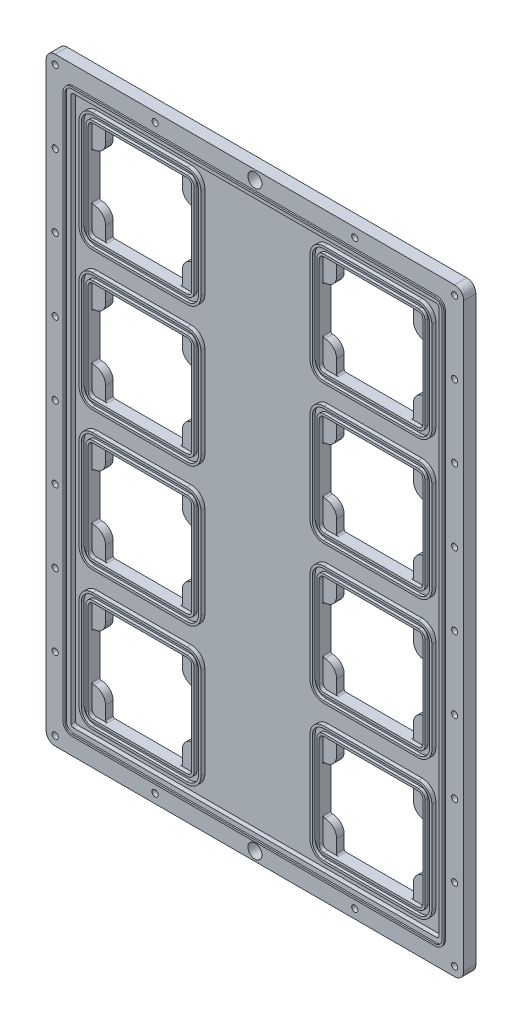
from build123d import *

# Parameters (mm, degrees)
SKETCH1_W            = 292.1
SKETCH1_H            = 419.1
BOSS_EXTRUDE1_DEPTH  = 8.509
SKETCH4_R            = 2.15265
CUT_EXTRUDE1_DEPTH   = 511.92036863
LPATTERN2_COUNT      = 8
LPATTERN2_PITCH      = 50.8
LPATTERN3_COUNT      = 4
LPATTERN3_PITCH      = 69.85
CUT_EXTRUDE3_DEPTH   = 3.175
BOSS_EXTRUDE2_DEPTH  = 1.016
SKETCH7_R            = 4.9022
CUT_EXTRUDE4_DEPTH   = 511.92036863
FILLET1_R            = 6.35
CUT_EXTRUDE5_DEPTH   = 3.175
CUT_EXTRUDE6_DEPTH   = 511.938299235
SKETCH11_R           = 1.1303
CUT_EXTRUDE7_DEPTH   = 3.96875
BOSS_EXTRUDE3_DEPTH  = 2.794
BOSS_EXTRUDE4_DEPTH  = 0.79375
LPATTERN1_COUNT      = 2
LPATTERN1_PITCH      = 161.5948
LPATTERN1_COUNT_DIR2 = 4
LPATTERN1_PITCH_DIR2 = 96.8756


with BuildPart() as part:
    # Sketch1 → Boss-Extrude1 (new body)
    with BuildSketch(Plane.XY):
        with Locations((146.05, 209.55)):
            Rectangle(SKETCH1_W, SKETCH1_H)
    extrude(amount=BOSS_EXTRUDE1_DEPTH)

    # Sketch4 → Cut-Extrude1 (cut, through all)
    with BuildSketch(Plane.XY.offset(8.509)):
        with Locations((6.35, 6.35)):
            Circle(SKETCH4_R)
        with Locations((6.35, 412.75)):
            Circle(SKETCH4_R)
        with Locations((285.75, 412.75)):
            Circle(SKETCH4_R)
        with Locations((285.75, 6.35)):
            Circle(SKETCH4_R)
    cut_extrude1 = extrude(amount=-CUT_EXTRUDE1_DEPTH, mode=Mode.SUBTRACT)

    # LPattern2: Cut-Extrude1 ×8
    with Locations(*[(0, -i * LPATTERN2_PITCH, 0) for i in range(1, LPATTERN2_COUNT)]):
        add(cut_extrude1, mode=Mode.SUBTRACT)

    # LPattern3: Cut-Extrude1 ×4
    with Locations(*[(-i * LPATTERN3_PITCH, 0, 0) for i in range(1, LPATTERN3_COUNT)]):
        add(cut_extrude1, mode=Mode.SUBTRACT)

    # Sketch6 → Cut-Extrude3 (cut)
    with BuildSketch(Plane.XY.offset(8.509)):
        with BuildLine():
            Line((273.05, 401.6375), (19.05, 401.6375))
            ThreePointArc((19.05, 401.6375), (17.927467985, 401.172532015), (17.4625, 400.05))
            Line((17.4625, 400.05), (17.4625, 19.05))
            ThreePointArc((17.4625, 19.05), (17.927467985, 17.927467985), (19.05, 17.4625))
            Line((19.05, 17.4625), (273.05, 17.4625))
            ThreePointArc((273.05, 17.4625), (274.172532015, 17.927467985), (274.6375, 19.05))
            Line((274.6375, 19.05), (274.6375, 400.05))
            ThreePointArc((274.6375, 400.05), (274.172532015, 401.172532015), (273.05, 401.6375))
        make_face()
    extrude(amount=-CUT_EXTRUDE3_DEPTH, mode=Mode.SUBTRACT)

    # Sketch5 → Boss-Extrude2 (add)
    with BuildSketch(Plane.XY.offset(8.509)):
        with BuildLine():
            Line((12.827, 400.05), (12.827, 19.05))
            ThreePointArc((12.827, 19.05), (14.649674501, 14.649674501), (19.05, 12.827))
            Line((19.05, 12.827), (273.05, 12.827))
            ThreePointArc((273.05, 12.827), (277.450325499, 14.649674501), (279.273, 19.05))
            Line((279.273, 19.05), (279.273, 400.05))
            ThreePointArc((279.273, 400.05), (277.450325499, 404.450325499), (273.05, 406.273))
            Line((273.05, 406.273), (19.05, 406.273))
            ThreePointArc((19.05, 406.273), (14.649674501, 404.450325499), (12.827, 400.05))
        make_face()
        with BuildLine():
            ThreePointArc((273.05, 14.1605), (276.507398607, 15.592601393), (277.9395, 19.05))
            Line((277.9395, 19.05), (277.9395, 400.05))
            ThreePointArc((277.9395, 400.05), (276.507398607, 403.507398607), (273.05, 404.9395))
            Line((273.05, 404.9395), (19.05, 404.9395))
            ThreePointArc((19.05, 404.9395), (15.592601393, 403.507398607), (14.1605, 400.05))
            Line((14.1605, 400.05), (14.1605, 19.05))
            ThreePointArc((14.1605, 19.05), (15.592601393, 15.592601393), (19.05, 14.1605))
            Line((19.05, 14.1605), (273.05, 14.1605))
        make_face(mode=Mode.SUBTRACT)
    extrude(amount=BOSS_EXTRUDE2_DEPTH)

    # Sketch7 → Cut-Extrude4 (cut, through all)
    with BuildSketch(Plane.XY.offset(8.509)):
        with Locations((146.05, 6.35)):
            Circle(SKETCH7_R)
        with Locations((146.05, 412.75)):
            Circle(SKETCH7_R)
    extrude(amount=-CUT_EXTRUDE4_DEPTH, mode=Mode.SUBTRACT)

    # Fillet1
    fillet1_edges = [part.edges().sort_by_distance(p)[0] for p in [
        (0, 419.1, 4.2545),
        (292.1, 419.1, 4.2545),
        (292.1, 0, 4.2545),
        (0, 0, 4.2545),
    ]]
    fillet(fillet1_edges, radius=FILLET1_R)

    # Sketch8 → Cut-Extrude5 (cut)
    with BuildSketch(Plane(origin=(0, 0, 0), x_dir=(-1, 0, 0), z_dir=(0, 0, -1))):
        with BuildLine():
            Line((-201.2442, 393.7), (-252.4506, 393.7))
            ThreePointArc((-252.4506, 393.7), (-255.881057838, 392.279057838), (-257.302, 388.8486))
            Line((-257.302, 388.8486), (-257.302, 379.857))
            ThreePointArc((-257.302, 379.857), (-258.633668309, 376.642068309), (-261.8486, 375.3104))
            ThreePointArc((-261.8486, 375.3104), (-265.279057838, 373.889457838), (-266.7, 370.459))
            Line((-266.7, 370.459), (-266.7, 339.2678))
            ThreePointArc((-266.7, 339.2678), (-265.279057838, 335.837342162), (-261.8486, 334.4164))
            ThreePointArc((-261.8486, 334.4164), (-258.633668309, 333.084731691), (-257.302, 329.8698))
            Line((-257.302, 329.8698), (-257.302, 320.8782))
            ThreePointArc((-257.302, 320.8782), (-255.881057838, 317.447742162), (-252.4506, 316.0268))
            Line((-252.4506, 316.0268), (-201.2442, 316.0268))
            ThreePointArc((-201.2442, 316.0268), (-197.813742162, 317.447742162), (-196.3928, 320.8782))
            Line((-196.3928, 320.8782), (-196.3928, 329.8698))
            ThreePointArc((-196.3928, 329.8698), (-195.061131691, 333.084731691), (-191.8462, 334.4164))
            ThreePointArc((-191.8462, 334.4164), (-188.415742162, 335.837342162), (-186.9948, 339.2678))
            Line((-186.9948, 339.2678), (-186.9948, 370.459))
            ThreePointArc((-186.9948, 370.459), (-188.415742162, 373.889457838), (-191.8462, 375.3104))
            ThreePointArc((-191.8462, 375.3104), (-195.061131691, 376.642068309), (-196.3928, 379.857))
            Line((-196.3928, 379.857), (-196.3928, 388.8486))
            ThreePointArc((-196.3928, 388.8486), (-197.813742162, 392.279057838), (-201.2442, 393.7))
        make_face()
        with BuildLine():
            Line((-264.668, 370.459), (-264.668, 339.2678))
            ThreePointArc((-264.668, 339.2678), (-263.842216859, 337.274183141), (-261.8486, 336.4484))
            ThreePointArc((-261.8486, 336.4484), (-257.196827329, 334.521572671), (-255.27, 329.8698))
            Line((-255.27, 329.8698), (-255.27, 320.8782))
            ThreePointArc((-255.27, 320.8782), (-254.444216859, 318.884583141), (-252.4506, 318.0588))
            Line((-252.4506, 318.0588), (-201.2442, 318.0588))
            ThreePointArc((-201.2442, 318.0588), (-199.250583141, 318.884583141), (-198.4248, 320.8782))
            Line((-198.4248, 320.8782), (-198.4248, 329.8698))
            ThreePointArc((-198.4248, 329.8698), (-196.497972671, 334.521572671), (-191.8462, 336.4484))
            ThreePointArc((-191.8462, 336.4484), (-189.852583141, 337.274183141), (-189.0268, 339.2678))
            Line((-189.0268, 339.2678), (-189.0268, 370.459))
            ThreePointArc((-189.0268, 370.459), (-189.852583141, 372.452616859), (-191.8462, 373.2784))
            ThreePointArc((-191.8462, 373.2784), (-196.497972671, 375.205227329), (-198.4248, 379.857))
            Line((-198.4248, 379.857), (-198.4248, 388.8486))
            ThreePointArc((-198.4248, 388.8486), (-199.250583141, 390.842216859), (-201.2442, 391.668))
            Line((-201.2442, 391.668), (-252.4506, 391.668))
            ThreePointArc((-252.4506, 391.668), (-254.444216859, 390.842216859), (-255.27, 388.8486))
            Line((-255.27, 388.8486), (-255.27, 379.857))
            ThreePointArc((-255.27, 379.857), (-257.196827329, 375.205227329), (-261.8486, 373.2784))
            ThreePointArc((-261.8486, 373.2784), (-263.842216859, 372.452616859), (-264.668, 370.459))
        make_face(mode=Mode.SUBTRACT)
    cut_extrude5 = extrude(amount=-CUT_EXTRUDE5_DEPTH, mode=Mode.SUBTRACT)

    # Sketch10 → Cut-Extrude6 (cut, through all)
    with BuildSketch(Plane(origin=(0, 0, 0), x_dir=(-1, 0, 0), z_dir=(0, 0, -1))):
        with BuildLine():
            Line((-263.0805, 370.459), (-263.0805, 339.2678))
            ThreePointArc((-263.0805, 339.2678), (-262.719684844, 338.396715156), (-261.8486, 338.0359))
            ThreePointArc((-261.8486, 338.0359), (-256.074295314, 335.644104686), (-253.6825, 329.8698))
            Line((-253.6825, 329.8698), (-253.6825, 320.8782))
            ThreePointArc((-253.6825, 320.8782), (-253.321684844, 320.007115156), (-252.4506, 319.6463))
            Line((-252.4506, 319.6463), (-201.2442, 319.6463))
            ThreePointArc((-201.2442, 319.6463), (-200.373115156, 320.007115156), (-200.0123, 320.8782))
            Line((-200.0123, 320.8782), (-200.0123, 329.8698))
            ThreePointArc((-200.0123, 329.8698), (-197.620504686, 335.644104686), (-191.8462, 338.0359))
            ThreePointArc((-191.8462, 338.0359), (-190.975115156, 338.396715156), (-190.6143, 339.2678))
            Line((-190.6143, 339.2678), (-190.6143, 370.459))
            ThreePointArc((-190.6143, 370.459), (-190.975115156, 371.330084844), (-191.8462, 371.6909))
            ThreePointArc((-191.8462, 371.6909), (-197.620504686, 374.082695314), (-200.0123, 379.857))
            Line((-200.0123, 379.857), (-200.0123, 388.8486))
            ThreePointArc((-200.0123, 388.8486), (-200.373115156, 389.719684844), (-201.2442, 390.0805))
            Line((-201.2442, 390.0805), (-252.4506, 390.0805))
            ThreePointArc((-252.4506, 390.0805), (-253.321684844, 389.719684844), (-253.6825, 388.8486))
            Line((-253.6825, 388.8486), (-253.6825, 379.857))
            ThreePointArc((-253.6825, 379.857), (-256.074295314, 374.082695314), (-261.8486, 371.6909))
            ThreePointArc((-261.8486, 371.6909), (-262.719684844, 371.330084844), (-263.0805, 370.459))
        make_face()
    cut_extrude6 = extrude(amount=-CUT_EXTRUDE6_DEPTH, mode=Mode.SUBTRACT)

    # Sketch11 → Cut-Extrude7 (cut)
    with BuildSketch(Plane(origin=(0, 0, 0), x_dir=(-1, 0, 0), z_dir=(0, 0, -1))):
        with Locations((-261.8486, 388.8994)):
            Circle(SKETCH11_R)
        with Locations((-191.8462, 388.8994)):
            Circle(SKETCH11_R)
        with Locations((-191.8462, 320.8274)):
            Circle(SKETCH11_R)
        with Locations((-261.8486, 320.8274)):
            Circle(SKETCH11_R)
    cut_extrude7 = extrude(amount=-CUT_EXTRUDE7_DEPTH, mode=Mode.SUBTRACT)

    # Sketch12 → Boss-Extrude3 (add)
    # profile 1 of 2: a face of its own
    with BuildSketch(Plane.XY.offset(5.334)):
        with BuildLine():
            Line((193.7893, 396.4305), (259.9055, 396.4305))
            ThreePointArc((259.9055, 396.4305), (266.640692091, 393.640692091), (269.4305, 386.9055))
            Line((269.4305, 386.9055), (269.4305, 322.8213))
            ThreePointArc((269.4305, 322.8213), (266.640692091, 316.086107909), (259.9055, 313.2963))
            Line((259.9055, 313.2963), (193.7893, 313.2963))
            ThreePointArc((193.7893, 313.2963), (187.054107909, 316.086107909), (184.2643, 322.8213))
            Line((184.2643, 322.8213), (184.2643, 386.9055))
            ThreePointArc((184.2643, 386.9055), (187.054107909, 393.640692091), (193.7893, 396.4305))
        make_face()
        with BuildLine():
            ThreePointArc((193.7893, 394.843), (188.176639924, 392.518160076), (185.8518, 386.9055))
            Line((185.8518, 386.9055), (185.8518, 322.8213))
            ThreePointArc((185.8518, 322.8213), (188.176639924, 317.208639924), (193.7893, 314.8838))
            Line((193.7893, 314.8838), (259.9055, 314.8838))
            ThreePointArc((259.9055, 314.8838), (265.518160076, 317.208639924), (267.843, 322.8213))
            Line((267.843, 322.8213), (267.843, 386.9055))
            ThreePointArc((267.843, 386.9055), (265.518160076, 392.518160076), (259.9055, 394.843))
            Line((259.9055, 394.843), (193.7893, 394.843))
        make_face(mode=Mode.SUBTRACT)
    # profile 2 of 2: a face of its own
    with BuildSketch(Plane.XY.offset(5.334)):
        with BuildLine():
            Line((193.7893, 391.668), (259.9055, 391.668))
            ThreePointArc((259.9055, 391.668), (263.273096045, 390.273096045), (264.668, 386.9055))
            Line((264.668, 386.9055), (264.668, 322.8213))
            ThreePointArc((264.668, 322.8213), (263.273096045, 319.453703955), (259.9055, 318.0588))
            Line((259.9055, 318.0588), (193.7893, 318.0588))
            ThreePointArc((193.7893, 318.0588), (190.421703955, 319.453703955), (189.0268, 322.8213))
            Line((189.0268, 322.8213), (189.0268, 386.9055))
            ThreePointArc((189.0268, 386.9055), (190.421703955, 390.273096045), (193.7893, 391.668))
        make_face()
        with BuildLine():
            ThreePointArc((193.7893, 390.0805), (191.54423597, 389.15056403), (190.6143, 386.9055))
            Line((190.6143, 386.9055), (190.6143, 322.8213))
            ThreePointArc((190.6143, 322.8213), (191.54423597, 320.57623597), (193.7893, 319.6463))
            Line((193.7893, 319.6463), (259.9055, 319.6463))
            ThreePointArc((259.9055, 319.6463), (262.15056403, 320.57623597), (263.0805, 322.8213))
            Line((263.0805, 322.8213), (263.0805, 386.9055))
            ThreePointArc((263.0805, 386.9055), (262.15056403, 389.15056403), (259.9055, 390.0805))
            Line((259.9055, 390.0805), (193.7893, 390.0805))
        make_face(mode=Mode.SUBTRACT)
    boss_extrude3 = extrude(amount=BOSS_EXTRUDE3_DEPTH)

    # Sketch12<3> → Boss-Extrude4 (add)
    with BuildSketch(Plane.XY.offset(5.334)):
        with BuildLine():
            Line((193.7893, 394.843), (259.9055, 394.843))
            ThreePointArc((259.9055, 394.843), (265.518160076, 392.518160076), (267.843, 386.9055))
            Line((267.843, 386.9055), (267.843, 322.8213))
            ThreePointArc((267.843, 322.8213), (265.518160076, 317.208639924), (259.9055, 314.8838))
            Line((259.9055, 314.8838), (193.7893, 314.8838))
            ThreePointArc((193.7893, 314.8838), (188.176639924, 317.208639924), (185.8518, 322.8213))
            Line((185.8518, 322.8213), (185.8518, 386.9055))
            ThreePointArc((185.8518, 386.9055), (188.176639924, 392.518160076), (193.7893, 394.843))
        make_face()
        with BuildLine():
            ThreePointArc((193.7893, 391.668), (190.421703955, 390.273096045), (189.0268, 386.9055))
            Line((189.0268, 386.9055), (189.0268, 322.8213))
            ThreePointArc((189.0268, 322.8213), (190.421703955, 319.453703955), (193.7893, 318.0588))
            Line((193.7893, 318.0588), (259.9055, 318.0588))
            ThreePointArc((259.9055, 318.0588), (263.273096045, 319.453703955), (264.668, 322.8213))
            Line((264.668, 322.8213), (264.668, 386.9055))
            ThreePointArc((264.668, 386.9055), (263.273096045, 390.273096045), (259.9055, 391.668))
            Line((259.9055, 391.668), (193.7893, 391.668))
        make_face(mode=Mode.SUBTRACT)
    boss_extrude4 = extrude(amount=BOSS_EXTRUDE4_DEPTH)

    # LPattern1: Cut-Extrude5, Cut-Extrude6, Cut-Extrude7, Boss-Extrude3, Boss-Extrude4 2 × 4
    with Locations(*[(-i * LPATTERN1_PITCH, -j * LPATTERN1_PITCH_DIR2, 0) for i in range(LPATTERN1_COUNT) for j in range(LPATTERN1_COUNT_DIR2) if (i, j) != (0, 0)]):
        add(cut_extrude5, mode=Mode.SUBTRACT)
        add(cut_extrude6, mode=Mode.SUBTRACT)
        add(cut_extrude7, mode=Mode.SUBTRACT)
        add(boss_extrude3)
        add(boss_extrude4)


solid = part.part
